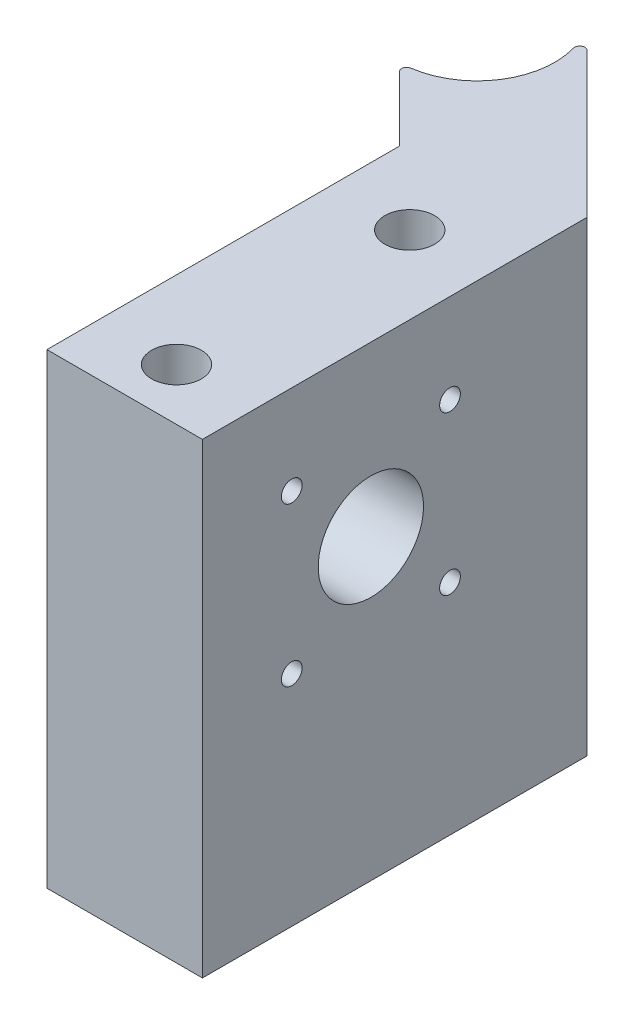
from build123d import *

# Parameters (mm, degrees)
SKETCH1_R           = 2.4
BOSS_EXTRUDE1_DEPTH = 45
CUT_EXTRUDE1_REACH  = 71.934
SKETCH2_R           = 5.0800000000000045
SKETCH2_R_2         = 1.0000000000000009
SKETCH2_R_3         = 1.0000000000000018
FILLET1_R           = 0.5
CUT_EXTRUDE2_DEPTH  = 2
CUT_EXTRUDE3_START  = 17
CUT_EXTRUDE3_DEPTH  = 2


with BuildPart() as part:
    # Sketch1 → Boss-Extrude1 (new body)
    with BuildSketch(Plane(origin=(0, 0, 0), x_dir=(1, 0, 0), z_dir=(0, 1, 0))):
        with BuildLine():
            Line((-7.499999999999999, -5.000000000000001), (7.500000000000001, -4.999999999999999))
            Line((7.500000000000001, -5), (7.4999999999999964, 32.10660171779804))
            Line((7.499999999999998, 32.10660171779804), (-9.196699141100867, 48.80330085889908))
            ThreePointArc((-9.196699141100867, 48.80330085889908), (-7.57090350616536, 40.62987425726181), (-14.499999999999998, 36))
            Line((-14.499999999999998, 36), (-7.5, 28.999999999999925))
            Line((-7.5, 28.99999999999993), (-7.499999999999999, -5.000000000000001))
        make_face()
        Circle(SKETCH1_R, mode=Mode.SUBTRACT)
        with Locations((0, 22.5)):
            Circle(SKETCH1_R, mode=Mode.SUBTRACT)
    extrude(amount=BOSS_EXTRUDE1_DEPTH)

    # Sketch2 → Cut-Extrude1 (cut, up to next)
    with BuildSketch(Plane(origin=(7.5, 0, -8.8e-16), x_dir=(-1.2e-16, 0, -1), z_dir=(1, 0, -1.2e-16)), mode=Mode.PRIVATE) as cut_extrude1_sk1:
        with Locations((11.25, 28.749999999999996)):
            Circle(SKETCH2_R)
    cut_extrude1_tool1 = extrude(cut_extrude1_sk1.sketch, amount=-CUT_EXTRUDE1_REACH, mode=Mode.PRIVATE) & part.part
    # Sketch2 → Cut-Extrude1 (cut, up to next)
    with BuildSketch(Plane(origin=(7.5, 0, -8.8e-16), x_dir=(-1.2e-16, 0, -1), z_dir=(1, 0, -1.2e-16)), mode=Mode.PRIVATE) as cut_extrude1_sk2:
        with Locations((3.6169999999999987, 36.382999999999996)):
            Circle(SKETCH2_R_2)
    cut_extrude1_tool2 = extrude(cut_extrude1_sk2.sketch, amount=-CUT_EXTRUDE1_REACH, mode=Mode.PRIVATE) & part.part
    # Sketch2 → Cut-Extrude1 (cut, up to next)
    with BuildSketch(Plane(origin=(7.5, 0, -8.8e-16), x_dir=(-1.2e-16, 0, -1), z_dir=(1, 0, -1.2e-16)), mode=Mode.PRIVATE) as cut_extrude1_sk3:
        with Locations((18.882999999999996, 36.382999999999996)):
            Circle(SKETCH2_R_3)
    cut_extrude1_tool3 = extrude(cut_extrude1_sk3.sketch, amount=-CUT_EXTRUDE1_REACH, mode=Mode.PRIVATE) & part.part
    # Sketch2 → Cut-Extrude1 (cut, up to next)
    with BuildSketch(Plane(origin=(7.5, 0, -8.8e-16), x_dir=(-1.2e-16, 0, -1), z_dir=(1, 0, -1.2e-16)), mode=Mode.PRIVATE) as cut_extrude1_sk4:
        with Locations((18.882999999999996, 21.117)):
            Circle(SKETCH2_R_3)
    cut_extrude1_tool4 = extrude(cut_extrude1_sk4.sketch, amount=-CUT_EXTRUDE1_REACH, mode=Mode.PRIVATE) & part.part
    # Sketch2 → Cut-Extrude1 (cut, up to next)
    with BuildSketch(Plane(origin=(7.5, 0, -8.8e-16), x_dir=(-1.2e-16, 0, -1), z_dir=(1, 0, -1.2e-16)), mode=Mode.PRIVATE) as cut_extrude1_sk5:
        with Locations((3.6170000000000004, 21.117)):
            Circle(SKETCH2_R_2)
    cut_extrude1_tool5 = extrude(cut_extrude1_sk5.sketch, amount=-CUT_EXTRUDE1_REACH, mode=Mode.PRIVATE) & part.part
    add(cut_extrude1_tool1.solids().sort_by_distance((7.5, 28.75, -11.25))[0], mode=Mode.SUBTRACT)
    add(cut_extrude1_tool2.solids().sort_by_distance((7.5, 36.383, -3.617))[0], mode=Mode.SUBTRACT)
    add(cut_extrude1_tool3.solids().sort_by_distance((7.5, 36.383, -18.883))[0], mode=Mode.SUBTRACT)
    add(cut_extrude1_tool4.solids().sort_by_distance((7.5, 21.117, -18.883))[0], mode=Mode.SUBTRACT)
    add(cut_extrude1_tool5.solids().sort_by_distance((7.5, 21.117, -3.617))[0], mode=Mode.SUBTRACT)

    # Fillet1
    fillet1_edges = [part.edges().sort_by_distance(p)[0] for p in [
        (-9.196699141100865, 22.5, -48.80330085889908),
        (-14.499999999999998, 22.5, -36),
    ]]
    fillet(fillet1_edges, radius=FILLET1_R)

    # Sketch3 → Cut-Extrude2 (cut, symmetric)
    with BuildSketch(Plane(origin=(0, 22.5, 0), x_dir=(1, 0, 0), z_dir=(0, 1, 0))):
        with BuildLine():
            Line((-8.136038969321103, 37.136038969321035), (-2.832738110421976, 42.43933982822012))
            Line((-2.832738110421976, 42.43933982822012), (-1.772077938642161, 41.37867965644029))
            Line((-1.772077938642161, 41.37867965644029), (-7.075378797541295, 36.07537879754122))
            ThreePointArc((-7.075378797541295, 36.07537879754122), (-9.276718417433415, 34.391359623455294), (-11.841997191011876, 33.34199719101185))
            Line((-11.841997191011876, 33.34199719101185), (-13.108259049699234, 34.608259049699214))
            ThreePointArc((-13.108259049699234, 34.608259049699214), (-10.421379383302025, 35.47722904072127), (-8.136038969321103, 37.136038969321035))
        make_face()
    extrude(amount=CUT_EXTRUDE2_DEPTH, both=True, mode=Mode.SUBTRACT)

    # Sketch3<2> → Cut-Extrude3 (cut, symmetric)
    with BuildSketch(Plane(origin=(0, 22.5, 0), x_dir=(1, 0, 0), z_dir=(0, 1, 0)).offset(CUT_EXTRUDE3_START)):
        with BuildLine():
            Line((-8.136038969321103, 37.136038969321035), (-2.832738110421976, 42.43933982822012))
            Line((-2.832738110421976, 42.43933982822012), (-1.772077938642161, 41.37867965644029))
            Line((-1.772077938642161, 41.37867965644029), (-7.075378797541295, 36.07537879754122))
            ThreePointArc((-7.075378797541295, 36.07537879754122), (-9.276718417433415, 34.391359623455294), (-11.841997191011876, 33.34199719101185))
            Line((-11.841997191011876, 33.34199719101185), (-13.108259049699234, 34.608259049699214))
            ThreePointArc((-13.108259049699234, 34.608259049699214), (-10.421379383302025, 35.47722904072127), (-8.136038969321103, 37.136038969321035))
        make_face()
    cut_extrude3 = extrude(amount=CUT_EXTRUDE3_DEPTH, both=True, mode=Mode.SUBTRACT)

    # Mirror1: Cut-Extrude3 across plane
    add(cut_extrude3.mirror(Plane.ZX.offset(22.5)), mode=Mode.SUBTRACT)


solid = part.part
